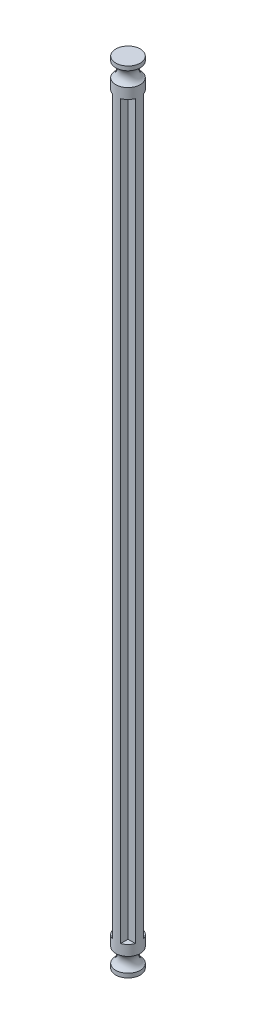
from build123d import *
from build123d.topology import SkipClean

# Parameters (mm, degrees)
EXTRUDE_2_DEPTH = 176.23


with BuildPart() as part:
    # 草图1 → 凸台-拉伸2 (new body)
    with BuildSketch(Plane(origin=(0, 0, 0), x_dir=(1, 0, 0), z_dir=(0, 1, 0))):
        with BuildLine():
            Line((1, 1), (1, 2.775337817))
            ThreePointArc((1, 2.775337817), (0, 2.95), (-1, 2.775337817))
            Line((-1, 2.775337817), (-1, 1))
            Line((-1, 1), (-2.775337817, 1))
            ThreePointArc((-2.775337817, 1), (-2.95, 0), (-2.775337817, -1))
            Line((-2.775337817, -1), (-1, -1))
            Line((-1, -1), (-1, -2.775337817))
            ThreePointArc((-1, -2.775337817), (0, -2.95), (1, -2.775337817))
            Line((1, -2.775337817), (1, -1))
            Line((1, -1), (2.775337817, -1))
            ThreePointArc((2.775337817, -1), (2.95, 0), (2.775337817, 1))
            Line((2.775337817, 1), (1, 1))
        make_face()
    extrude(amount=EXTRUDE_2_DEPTH)

    # 草图3 → 旋转3 (revolve)
    with SkipClean():  # the faces are left unmerged after this step: merging them gives an invalid solid
        with BuildSketch(Plane(origin=(0, 0, 0), x_dir=(0, 0, -1), z_dir=(1, 0, 0))):
            with BuildLine():
                Line((0, 176.23), (0, 183.23))
                Line((0, 183.23), (2.95, 183.23))
                Line((2.95, 183.23), (2.95, 182.23))
                ThreePointArc((2.95, 182.23), (1.918245837, 180.48), (2.95, 178.73))
                Line((2.95, 178.73), (2.95, 176.23))
                Line((2.95, 176.23), (0, 176.23))
            make_face()
            with BuildLine():
                Line((0, 0), (0, -7))
                Line((0, -7), (2.95, -7))
                Line((2.95, -7), (2.95, -6))
                ThreePointArc((2.95, -6), (1.918245837, -4.25), (2.95, -2.5))
                Line((2.95, -2.5), (2.95, 0))
                Line((2.95, 0), (0, 0))
            make_face()
        revolve(axis=Axis((0, 0, 0), (0, -1, 0)))


solid = part.part
